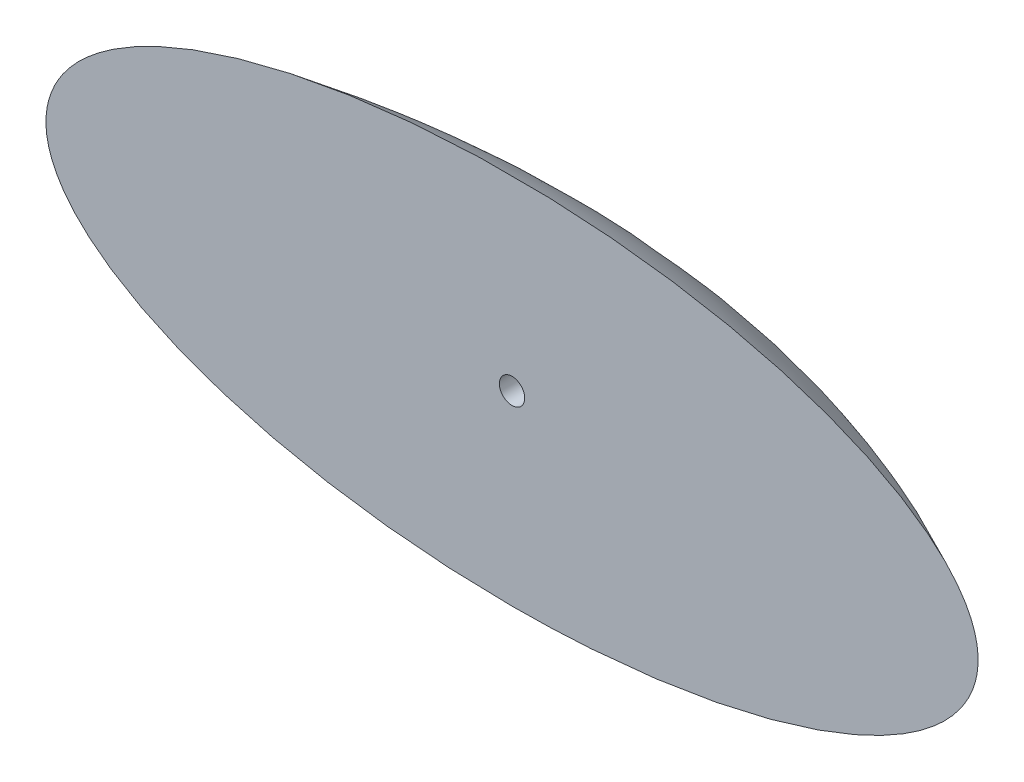
from build123d import *

# Parameters (mm, degrees)
BEAM_SCALE_X         = 1
BEAM_SCALE_Y         = 4
BEAM_SCALE_Z         = 1
LENGTH_SCALE_X       = 10
LENGTH_SCALE_Y       = 1
LENGTH_SCALE_Z       = 1
MAST_HOLE_DEPTH      = 292.823782601
MAST_HOLE_DEPTH_BACK = 101.6
SKETCH16_R           = 5.08
LAYER_START          = -50.8
SKETCH15_3_W         = 508
SKETCH15_3_H         = 203.2
LAYER_3_DEPTH        = 50.8


with BuildPart() as part:
    # YZ Section_depthOnly → Depth (revolve)
    with BuildSketch(Plane(origin=(0, 0, 0), x_dir=(0, 0, -1), z_dir=(1, 0, 0))):
        with BuildLine():
            Line((0, 0), (0, -25.4))
            add(Edge.make_bspline(
                [(0, -25.4), (101.6, -14.816666667), (101.6, 0)],
                knots=[5.507991934, 5.507991934, 5.507991934, 6.283185307, 6.283185307, 6.283185307], degree=2, weights=[1, 0.9258201, 1]))
            Line((101.6, 0), (0, 0))
        make_face()
    revolve(axis=Axis((0, 0, 254), (0, 0, -1)))

    # Sketch13 → Height (revolve)
    with BuildSketch(Plane(origin=(0, 0, 0), x_dir=(0, 0, -1), z_dir=(1, 0, 0))):
        with BuildLine():
            Line((0, 0), (-50.8, 0))
            add(Edge.make_bspline(
                [(-50.8, 0), (-50.8, -23.988888889), (0, -25.4)],
                knots=[0, 0, 0, 1.511938821, 1.511938821, 1.511938821], degree=2, weights=[1, 0.727606875, 1]))
            Line((0, -25.4), (0, 0))
        make_face()
    revolve(axis=Axis((0, 0, 0), (0, 0, 1)))


with BuildPart() as part_1:
    # Beam: scaled about (0, 0, 0)
    add(part.part.scale((BEAM_SCALE_X, BEAM_SCALE_Y, BEAM_SCALE_Z), about=(0, 0, 0)))


with BuildPart() as part_2:
    # Length: scaled about (0, 0, 0)
    add(part_1.part.scale((LENGTH_SCALE_X, LENGTH_SCALE_Y, LENGTH_SCALE_Z), about=(0, 0, 0)))

    # Sketch16 → Mast Hole (cut, two sides: drawn at the far end of the back side and taken through both)
    with BuildSketch(Plane.XY.offset(-MAST_HOLE_DEPTH_BACK)):
        Circle(SKETCH16_R)
    extrude(amount=MAST_HOLE_DEPTH + MAST_HOLE_DEPTH_BACK, mode=Mode.SUBTRACT)


with BuildPart() as body_2:
    # Sketch15<3> → Layer 3 (new body)
    with BuildSketch(Plane.XY.offset(LAYER_START)):
        Rectangle(SKETCH15_3_W, SKETCH15_3_H)
    extrude(amount=-LAYER_3_DEPTH)


with BuildPart() as part_3:
    add(part_2.part)

    # Layer 3 Body: intersect body 2
    add(body_2.part, mode=Mode.INTERSECT)


solid = part_3.part
